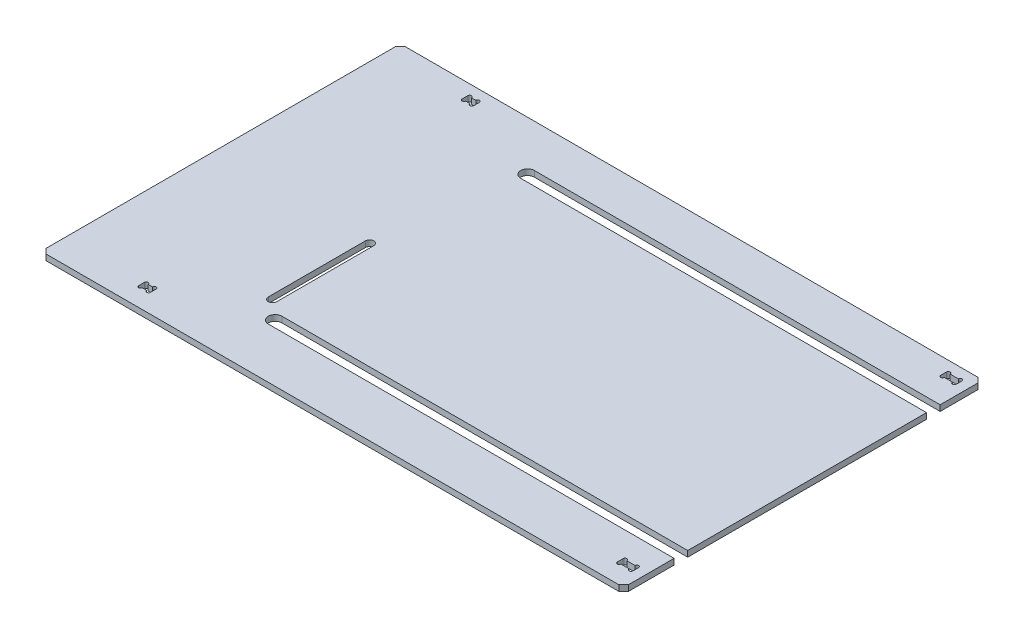
from build123d import *

# Parameters (mm, degrees)
SKETCH_1_W          = 300
SKETCH_1_H          = 185
EXTRUDE_1_DEPTH     = 3
CUT_EXTRUDE_1_DEPTH = 10
SKETCH_3_R          = 2.15
CUT_EXTRUDE_2_DEPTH = 10
SKETCH_4_W          = 209
SKETCH_4_H          = 7
CUT_EXTRUDE_3_DEPTH = 10
SKETCH_5_R          = 3.5
CUT_EXTRUDE_5_DEPTH = 10
CHAMFER_1_SIZE      = 2.5
SKETCH_6_W          = 6
SKETCH_6_H          = 3
SKETCH_6_W_2        = 8
CUT_EXTRUDE_6_DEPTH = 3
SKETCH_7_R          = 0.94219208
CUT_EXTRUDE_7_DEPTH = 10


with BuildPart() as part:
    # 스케치1 → 보스-돌출1 (new body)
    with BuildSketch(Plane(origin=(0, 0, 0), x_dir=(1, 0, 0), z_dir=(0, 1, 0))):
        with Locations((150, 92.5)):
            Rectangle(SKETCH_1_W, SKETCH_1_H)
    extrude(amount=EXTRUDE_1_DEPTH)

    # 스케치2 → 컷-돌출1 (cut)
    with BuildSketch(Plane(origin=(0, 3, 0), x_dir=(1, 0, 0), z_dir=(0, 1, 0))):
        Polygon((78.9, 63.106579113), (78.9, 88.106579113), (83.2, 88.106579113), (83.2, 38.106579113), (78.9, 38.106579113), align=None)
    extrude(amount=-CUT_EXTRUDE_1_DEPTH, mode=Mode.SUBTRACT)

    # 스케치3 → 컷-돌출2 (cut)
    with BuildSketch(Plane(origin=(0, 3, 0), x_dir=(1, 0, 0), z_dir=(0, 1, 0))):
        with Locations((81.05, 88.106579113)):
            Circle(SKETCH_3_R)
        with Locations((81.05, 38.106579113)):
            Circle(SKETCH_3_R)
    extrude(amount=-CUT_EXTRUDE_2_DEPTH, mode=Mode.SUBTRACT)

    # 스케치4 → 컷-돌출3 (cut)
    with BuildSketch(Plane(origin=(0, 3, 0), x_dir=(1, 0, 0), z_dir=(0, 1, 0))):
        with Locations((195.5, 159.5)):
            Rectangle(SKETCH_4_W, SKETCH_4_H)
        with Locations((195.5, 29.5)):
            Rectangle(SKETCH_4_W, SKETCH_4_H)
    extrude(amount=-CUT_EXTRUDE_3_DEPTH, mode=Mode.SUBTRACT)

    # 스케치5 → 컷-돌출5 (cut)
    with BuildSketch(Plane(origin=(0, 3, 0), x_dir=(1, 0, 0), z_dir=(0, 1, 0))):
        with Locations((91, 159.5)):
            Circle(SKETCH_5_R)
        with Locations((91, 29.5)):
            Circle(SKETCH_5_R)
    extrude(amount=-CUT_EXTRUDE_5_DEPTH, mode=Mode.SUBTRACT)

    # 모따기1
    chamfer_1_edges = [part.edges().sort_by_distance(p)[0] for p in [
        (0, 1.5, 0),
        (0, 1.5, -185),
        (300, 1.5, 0),
        (300, 1.5, -185),
    ]]
    chamfer(chamfer_1_edges, length=CHAMFER_1_SIZE)

    # 스케치6 → 컷-돌출6 (cut)
    with BuildSketch(Plane.XZ):
        with Locations((43.5, -177.75)):
            Rectangle(SKETCH_6_W, SKETCH_6_H)
        with Locations((291, -177.75)):
            Rectangle(SKETCH_6_W_2, SKETCH_6_H)
        with Locations((291, -11.25)):
            Rectangle(SKETCH_6_W_2, SKETCH_6_H)
        with Locations((43.5, -11.25)):
            Rectangle(SKETCH_6_W, SKETCH_6_H)
    extrude(amount=-CUT_EXTRUDE_6_DEPTH, mode=Mode.SUBTRACT)

    # 스케치7 → 컷-돌출7 (cut)
    with BuildSketch(Plane(origin=(0, 3, 0), x_dir=(1, 0, 0), z_dir=(0, 1, 0))):
        with Locations((41.44219208, 12.75)):
            Circle(SKETCH_7_R)
        with Locations((45.55780792, 12.75)):
            Circle(SKETCH_7_R)
        with Locations((45.55780792, 9.75)):
            Circle(SKETCH_7_R)
        with Locations((41.44219208, 9.75)):
            Circle(SKETCH_7_R)
        with Locations((294.05780792, 9.75)):
            Circle(SKETCH_7_R)
        with Locations((294.05780792, 12.75)):
            Circle(SKETCH_7_R)
        with Locations((287.94219208, 12.75)):
            Circle(SKETCH_7_R)
        with Locations((287.94219208, 9.75)):
            Circle(SKETCH_7_R)
        with Locations((287.94219208, 179.25)):
            Circle(SKETCH_7_R)
        with Locations((287.94219208, 176.25)):
            Circle(SKETCH_7_R)
        with Locations((294.05780792, 176.25)):
            Circle(SKETCH_7_R)
        with Locations((294.05780792, 179.25)):
            Circle(SKETCH_7_R)
        with Locations((41.44219208, 179.25)):
            Circle(SKETCH_7_R)
        with Locations((45.55780792, 179.25)):
            Circle(SKETCH_7_R)
        with Locations((45.55780792, 176.25)):
            Circle(SKETCH_7_R)
        with Locations((41.44219208, 176.25)):
            Circle(SKETCH_7_R)
    extrude(amount=-CUT_EXTRUDE_7_DEPTH, mode=Mode.SUBTRACT)


solid = part.part
